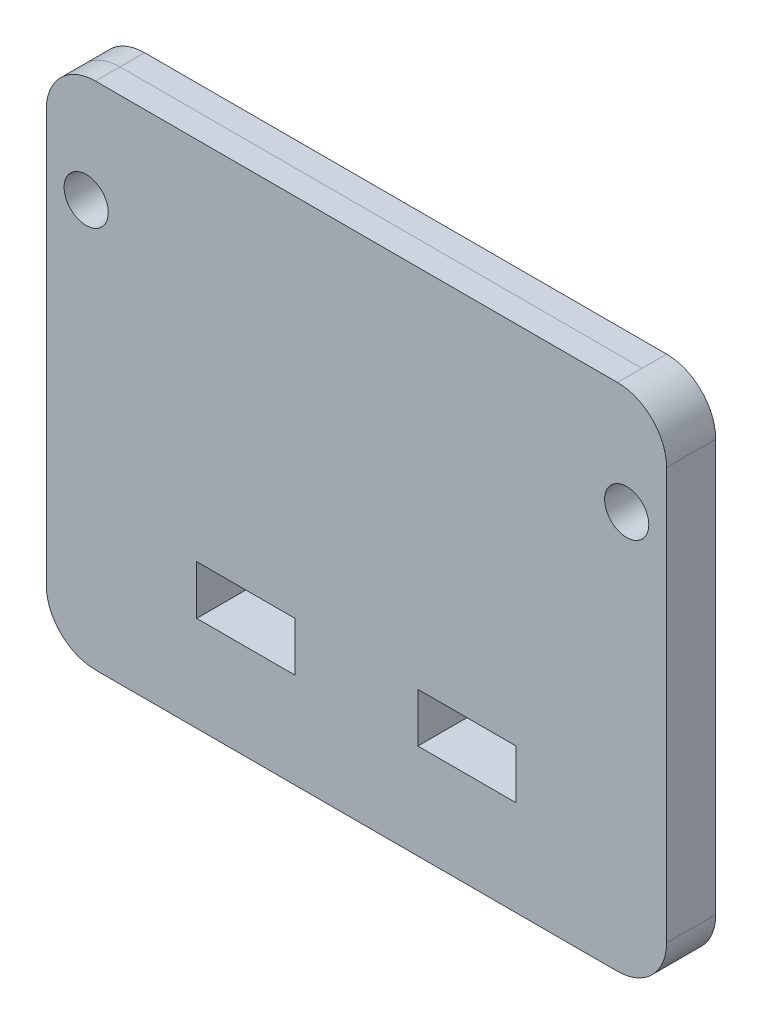
from build123d import *

# Parameters (mm, degrees)
SKETCH1_R                      = 11.422
BOSS_EXTRUDE1_DEPTH            = 25.4
SKETCH2_W                      = 50.8
SKETCH2_H                      = 25.4
FOAM_INSERT_CUT_THROUGHS_DEPTH = 25.4


with BuildPart() as part:
    # Sketch1 → Boss-Extrude1 (new body)
    with BuildSketch(Plane.XY):
        with BuildLine():
            Line((-134.937453137, -131.801904544), (134.937453137, -131.801904544))
            ThreePointArc((134.937453137, -131.801904544), (152.897965379, -124.362416786), (160.337453137, -106.401904544))
            Line((160.337453137, -106.401904544), (160.337453137, 106.401904544))
            ThreePointArc((160.337453137, 106.401904544), (152.897965379, 124.362416786), (134.937453137, 131.801904544))
            Line((134.937453137, 131.801904544), (-134.937453137, 131.801904544))
            ThreePointArc((-134.937453137, 131.801904544), (-152.897965379, 124.362416786), (-160.337453137, 106.401904544))
            Line((-160.337453137, 106.401904544), (-160.337453137, -106.401904544))
            ThreePointArc((-160.337453137, -106.401904544), (-152.897965379, -124.362416786), (-134.937453137, -131.801904544))
        make_face()
        with Locations((-139.7, 76.2)):
            Circle(SKETCH1_R, mode=Mode.SUBTRACT)
        with Locations((139.7, 76.2)):
            Circle(SKETCH1_R, mode=Mode.SUBTRACT)
    extrude(amount=BOSS_EXTRUDE1_DEPTH)

    # Sketch2 → Foam Insert Cut-Throughs (cut)
    with BuildSketch(Plane(origin=(0, 0, 0), x_dir=(-1, 0, 0), z_dir=(0, 0, -1))):
        with Locations((-57.15, -69.85)):
            Rectangle(SKETCH2_W, SKETCH2_H)
        with Locations((57.15, -69.85)):
            Rectangle(SKETCH2_W, SKETCH2_H)
    extrude(amount=-FOAM_INSERT_CUT_THROUGHS_DEPTH, mode=Mode.SUBTRACT)


solid = part.part
